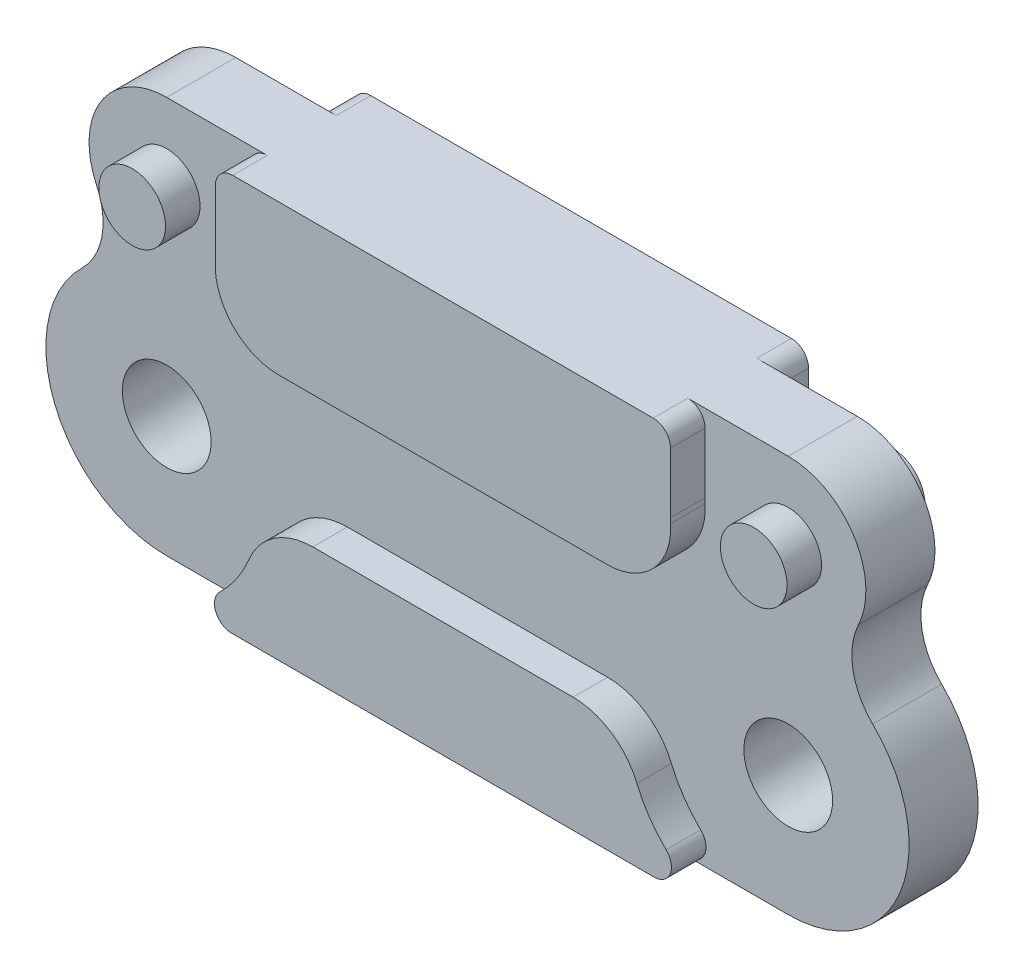
from build123d import *

# Parameters (mm, degrees)
SKETCH2_R            = 2.0399375
BOSS_EXTRUDE1_DEPTH  = 3.175
CUT_EXTRUDE2_START   = -1.5875
SKETCH4_R            = 2.0399375
SKETCH4_R_2          = 1.5319375
CUT_EXTRUDE2_DEPTH   = 1.5875
FILLET2_R            = 3.175
FILLET6_R            = 0.79375
FILLET2_OF_MIRROR2_R = 3.175
FILLET6_OF_MIRROR2_R = 0.79375


with BuildPart() as part:
    # Sketch2 → Boss-Extrude1 (new body)
    with BuildSketch(Plane.XY):
        with BuildLine():
            ThreePointArc((-14.2875, 12.7), (-17.304740851, 11.039812386), (-17.517188204, 7.602541465))
            ThreePointArc((-17.517188204, 7.602541465), (-17.263166528, 5.684416029), (-18.169650572, 3.975024654))
            ThreePointArc((-18.169650572, 3.975024654), (-19.433282001, -2.095910701), (-14.2875, -5.55625))
            Line((-14.2875, -5.55625), (14.2875, -5.55625))
            ThreePointArc((14.2875, -5.55625), (19.433282022, -2.095910648), (18.169650491, 3.975024733))
            ThreePointArc((18.169650491, 3.975024733), (17.263166503, 5.684416169), (17.517188276, 7.602541618))
            ThreePointArc((17.517188276, 7.602541618), (17.304740806, 11.039812458), (14.2875, 12.7))
            Line((14.2875, 12.7), (-14.2875, 12.7))
        make_face()
        with Locations((-14.2875, 0)):
            Circle(SKETCH2_R, mode=Mode.SUBTRACT)
        with Locations((14.2875, 0)):
            Circle(SKETCH2_R, mode=Mode.SUBTRACT)
    boss_extrude1 = extrude(amount=BOSS_EXTRUDE1_DEPTH)

    # Sketch4 → Cut-Extrude2 (cut)
    with BuildSketch(Plane.XY.offset(3.175).offset(CUT_EXTRUDE2_START)):
        with BuildLine():
            Line((0, 5.81025), (-7.552307909, 5.81025))
            ThreePointArc((-7.552307909, 5.81025), (-9.677647586, 6.727460525), (-10.468249898, 8.903073513))
            ThreePointArc((-10.468249898, 8.903073513), (-10.463281583, 9.015550512), (-10.461625, 9.128125))
            Line((-10.461625, 9.128125), (-10.461625, 12.7))
            Line((-10.461625, 12.7), (-14.2875, 12.7))
            ThreePointArc((-14.2875, 12.7), (-17.304740823, 11.039812431), (-17.517188249, 7.60254156))
            ThreePointArc((-17.517188249, 7.60254156), (-17.263166512, 5.684416116), (-18.169650521, 3.975024704))
            ThreePointArc((-18.169650521, 3.975024704), (-19.433282014, -2.095910668), (-14.2875, -5.55625))
            Line((-14.2875, -5.55625), (-12.588355804, -5.55625))
            ThreePointArc((-12.588355804, -5.55625), (-9.69344231, -3.557195384), (-8.482804568, -0.254))
            Line((-8.482804568, -0.254), (8.482804568, -0.254))
            ThreePointArc((8.482804568, -0.254), (9.69344231, -3.557195384), (12.588355804, -5.55625))
            Line((12.588355804, -5.55625), (14.2875, -5.55625))
            ThreePointArc((14.2875, -5.55625), (19.433282014, -2.095910668), (18.169650521, 3.975024704))
            ThreePointArc((18.169650521, 3.975024704), (17.263166512, 5.684416116), (17.517188249, 7.60254156))
            ThreePointArc((17.517188249, 7.60254156), (17.304740823, 11.039812431), (14.2875, 12.7))
            Line((14.2875, 12.7), (10.461625, 12.7))
            Line((10.461625, 12.7), (10.461625, 9.128125))
            ThreePointArc((10.461625, 9.128125), (10.463281583, 9.015550528), (10.468249896, 8.903073545))
            ThreePointArc((10.468249896, 8.903073545), (9.677647595, 6.727460535), (7.552307904, 5.81025))
            Line((7.552307904, 5.81025), (0, 5.81025))
        make_face()
        with Locations((-14.2875, 0)):
            Circle(SKETCH4_R, mode=Mode.SUBTRACT)
        with Locations((14.2875, 0)):
            Circle(SKETCH4_R, mode=Mode.SUBTRACT)
        with Locations((-14.2875, 9.128125)):
            Circle(SKETCH4_R_2, mode=Mode.SUBTRACT)
        with Locations((14.2875, 9.128125)):
            Circle(SKETCH4_R_2, mode=Mode.SUBTRACT)
    cut_extrude2 = extrude(amount=CUT_EXTRUDE2_DEPTH, mode=Mode.SUBTRACT)

    # Fillet2
    fillet2_edges = [part.edges().sort_by_distance(p)[0] for p in [
        (8.482804568, -0.254, 2.38125),
        (-8.482804568, -0.254, 2.38125),
    ]]
    fillet(fillet2_edges, radius=FILLET2_R)

    # Fillet6
    fillet6_edges = [part.edges().sort_by_distance(p)[0] for p in [
        (12.588355804, -5.55625, 2.38125),
        (-12.588355804, -5.55625, 2.38125),
        (10.461625, 12.7, 2.38125),
        (-10.461625, 12.7, 2.38125),
    ]]
    fillet(fillet6_edges, radius=FILLET6_R)

    # Mirror2: Boss-Extrude1, Cut-Extrude2 across plane
    add(boss_extrude1.mirror(Plane.XY))
    add(cut_extrude2.mirror(Plane.XY), mode=Mode.SUBTRACT)

    # Fillet2 of Mirror2
    fillet2_of_mirror2_edges = [part.edges().sort_by_distance(p)[0] for p in [
        (8.482804568, -0.254, -2.38125),
        (-8.482804568, -0.254, -2.38125),
    ]]
    fillet(fillet2_of_mirror2_edges, radius=FILLET2_OF_MIRROR2_R)

    # Fillet6 of Mirror2
    fillet6_of_mirror2_edges = [part.edges().sort_by_distance(p)[0] for p in [
        (12.588355804, -5.55625, -2.38125),
        (-12.588355804, -5.55625, -2.38125),
        (10.461625, 12.7, -2.38125),
        (-10.461625, 12.7, -2.38125),
    ]]
    fillet(fillet6_of_mirror2_edges, radius=FILLET6_OF_MIRROR2_R)


solid = part.part
